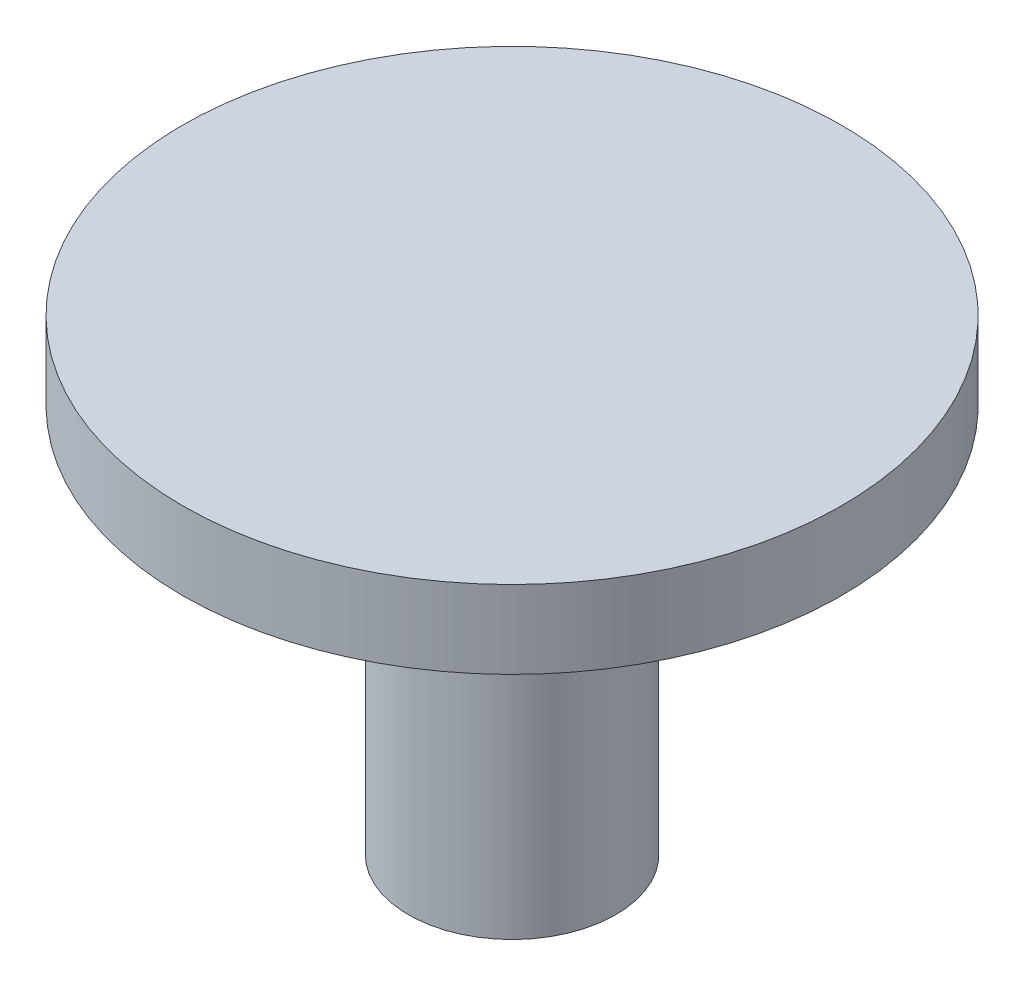
from build123d import *

# Parameters (mm, degrees)
CROQUIS1_R              = 12.7
SALIENTE_EXTRUIR1_DEPTH = 3
CROQUIS2_R              = 4
SALIENTE_EXTRUIR2_DEPTH = 15


with BuildPart() as part:
    # Croquis1 → Saliente-Extruir1 (new body)
    with BuildSketch(Plane(origin=(0, 0, 0), x_dir=(1, 0, 0), z_dir=(0, 1, 0))):
        Circle(CROQUIS1_R)
    extrude(amount=SALIENTE_EXTRUIR1_DEPTH)

    # Croquis2 → Saliente-Extruir2 (add)
    with BuildSketch(Plane.XZ):
        Circle(CROQUIS2_R)
    extrude(amount=SALIENTE_EXTRUIR2_DEPTH)


solid = part.part
